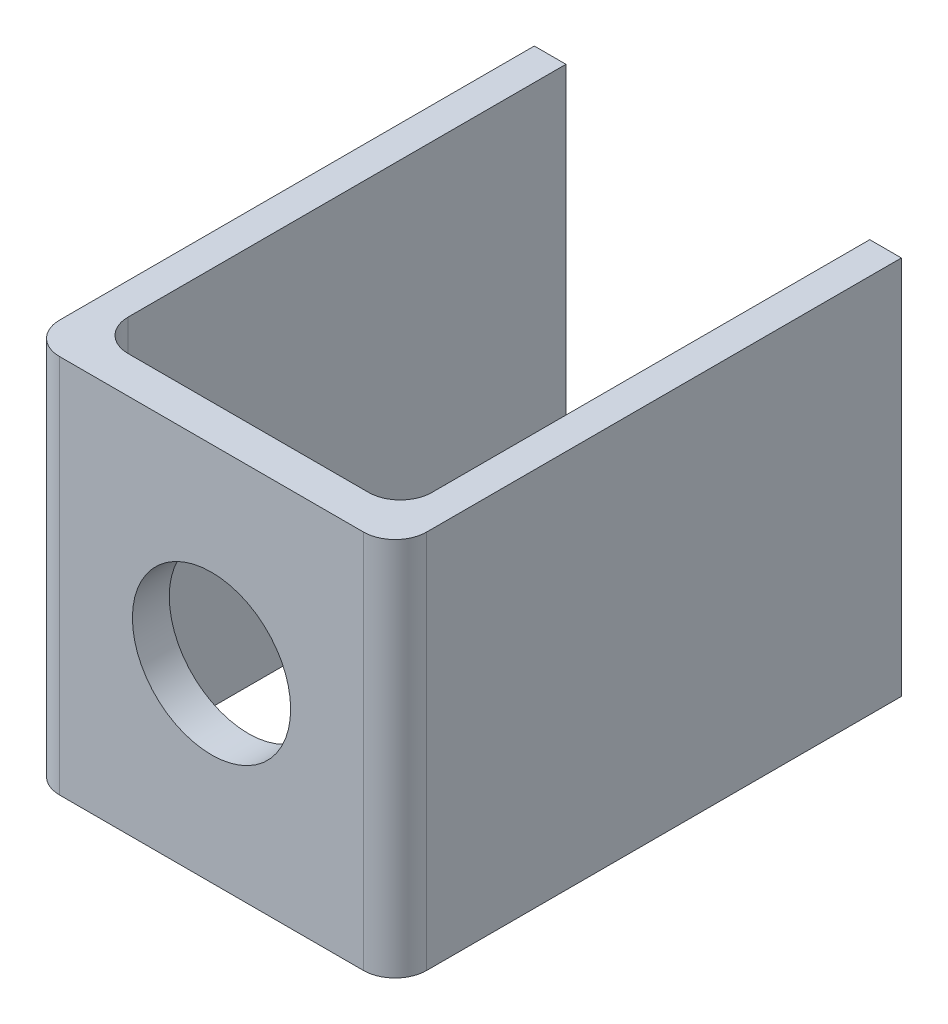
from build123d import *

# Parameters (mm, degrees)
EXTRUDE_1_DEPTH     = 60
SKETCH_2_R          = 12.5
CUT_EXTRUDE_1_DEPTH = 116.602768133


with BuildPart() as part:
    # Эскиз1 → Бобышка-Вытянуть1 (new body)
    with BuildSketch(Plane(origin=(0, 0, 0), x_dir=(1, 0, 0), z_dir=(0, 1, 0))):
        with BuildLine():
            Line((0, 80), (0, 5))
            ThreePointArc((0, 5), (1.464466094, 1.464466094), (5, 0))
            Line((5, 0), (53, 0))
            ThreePointArc((53, 0), (56.535533906, 1.464466094), (58, 5))
            Line((58, 5), (58, 80))
            Line((58, 80), (53, 80))
            Line((53, 80), (53, 10.822157735))
            ThreePointArc((53, 10.822157735), (51.535533906, 7.286623829), (48, 5.822157735))
            Line((48, 5.822157735), (10, 5.822157735))
            ThreePointArc((10, 5.822157735), (6.464466094, 7.286623829), (5, 10.822157735))
            Line((5, 10.822157735), (5, 80))
            Line((5, 80), (0, 80))
        make_face()
    extrude(amount=EXTRUDE_1_DEPTH)

    # Эскиз2 → Вырез-Вытянуть1 (cut, through all)
    with BuildSketch(Plane.XY):
        with Locations((29, 30)):
            Circle(SKETCH_2_R)
    extrude(amount=-CUT_EXTRUDE_1_DEPTH, mode=Mode.SUBTRACT)


solid = part.part
